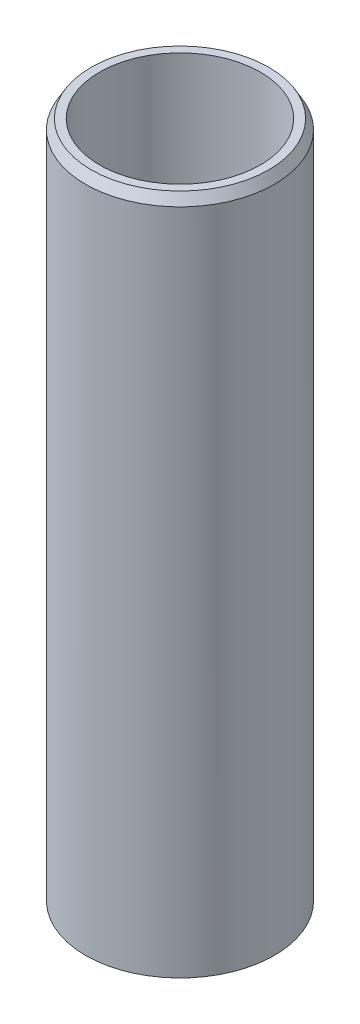
from build123d import *
from OCP.BRepFilletAPI import BRepFilletAPI_MakeChamfer

# Parameters (mm, degrees)
SKETCH1_R           = 42.5
BOSS_EXTRUDE1_DEPTH = 307.359399519
SKETCH2_R           = 36.198364146
CUT_EXTRUDE1_DEPTH  = 314.180938871
CHAMFER1_SIZE       = 4.380462903
CHAMFER1_SIZE2      = 2.529061436


with BuildPart() as part:
    # Sketch1 → Boss-Extrude1 (new body)
    with BuildSketch(Plane(origin=(0, 0, 0), x_dir=(1, 0, 0), z_dir=(0, 1, 0))):
        Circle(SKETCH1_R)
    extrude(amount=BOSS_EXTRUDE1_DEPTH)

    # Sketch2 → Cut-Extrude1 (cut, through all)
    with BuildSketch(Plane(origin=(0, 0, 0), x_dir=(1, 0, 0), z_dir=(0, 1, 0))):
        Circle(SKETCH2_R)
    extrude(amount=CUT_EXTRUDE1_DEPTH, mode=Mode.SUBTRACT)

    # Chamfer1: one chamfer whose edges measure the first distance from different faces: ONE call of the kernel's chamfer builder (chamfer() names one face for all edges)
    chamfer1_edges_1 = [part.edges().sort_by_distance(p)[0] for p in [
        (-42.5, 307.359399519, 0),
    ]]
    chamfer1_side_1 = [part.faces().sort_by_distance(p)[0] for p in [
        (-42.5, 153.679699759, 0),
    ]]
    chamfer1_edges_2 = [part.edges().sort_by_distance(p)[0] for p in [
        (-42.5, 0, 0),
    ]]
    chamfer1_side_2 = [part.faces().sort_by_distance(p)[0] for p in [
        (-41.297918472, 0, 0),
    ]]
    chamfer1 = BRepFilletAPI_MakeChamfer(part.part.solid().wrapped)
    for e in chamfer1_edges_1:
        chamfer1.Add(CHAMFER1_SIZE, CHAMFER1_SIZE2, e.wrapped, chamfer1_side_1[0].wrapped)  # the first distance lies on this face
    for e in chamfer1_edges_2:
        chamfer1.Add(CHAMFER1_SIZE, CHAMFER1_SIZE2, e.wrapped, chamfer1_side_2[0].wrapped)  # the first distance lies on this face
    add(Compound.cast(chamfer1.Shape()), mode=Mode.REPLACE)


solid = part.part
